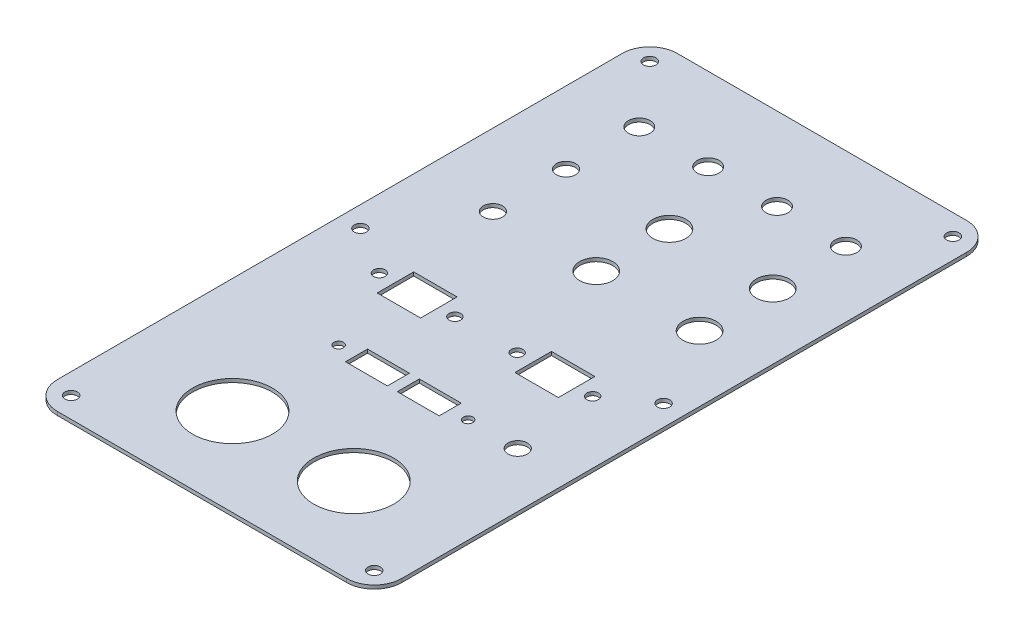
from build123d import *

# Parameters (mm, degrees)
SKETCH1_W          = 125
SKETCH1_H          = 225
BASE_FLANGE1_DEPTH = 1.3
SKETCH6_R          = 2.25
CUT_EXTRUDE1_DEPTH = 10
FILLET1_R          = 10
SKETCH7_R          = 14.5
SKETCH7_R_2        = 1.75
SKETCH7_R_3        = 2.1
SKETCH7_R_4        = 3.96875
SKETCH7_W          = 15.2
SKETCH7_H          = 8
SKETCH7_W_2        = 15.75
SKETCH7_H_2        = 13.25
CUT_EXTRUDE2_DEPTH = 10
SKETCH8_R          = 3.5
CUT_EXTRUDE3_DEPTH = 10
SKETCH9_R          = 6
CUT_EXTRUDE4_DEPTH = 10


# Sheet-metal steps are written as plain solids
with BuildPart() as part:
    # Sketch1 → Base-Flange1 (new body)
    with BuildSketch(Plane(origin=(0, 0, 0), x_dir=(1, 0, 0), z_dir=(0, 1, 0))):
        with Locations((-1.187869711, 10.618580575)):
            Rectangle(SKETCH1_W, SKETCH1_H)
    extrude(amount=-BASE_FLANGE1_DEPTH)

    # Sketch6 → Cut-Extrude1 (cut)
    with BuildSketch(Plane(origin=(0, 0, 0), x_dir=(1, 0, 0), z_dir=(0, 1, 0))):
        with Locations(Location((53.812130289, 115.618580576, 0), (0, 0, 270))):
            Circle(SKETCH6_R)
        with Locations(Location((53.812130289, -94.381419424, 0), (0, 0, 270))):
            Circle(SKETCH6_R)
        with Locations(Location((-56.187869711, -94.381419424, 0), (0, 0, 270))):
            Circle(SKETCH6_R)
        with Locations(Location((-56.187869711, 115.618580576, 0), (0, 0, 270))):
            Circle(SKETCH6_R)
        with Locations(Location((53.812130289, 10.618580576, 0), (0, 0, 270))):
            Circle(SKETCH6_R)
        with Locations(Location((-56.187869711, 10.618580576, 0), (0, 0, 270))):
            Circle(SKETCH6_R)
    extrude(amount=-CUT_EXTRUDE1_DEPTH, mode=Mode.SUBTRACT)

    # Fillet1
    fillet1_edges = [part.edges().sort_by_distance(p)[0] for p in [
        (61.312130289, -0.65, 101.881419425),
        (-63.687869711, -0.65, 101.881419425),
        (-63.687869711, -0.65, -123.118580575),
        (61.312130289, -0.65, -123.118580575),
    ]]
    fillet(fillet1_edges, radius=FILLET1_R)

    # Sketch7 → Cut-Extrude2 (cut)
    with BuildSketch(Plane(origin=(0, 0, 0), x_dir=(1, 0, 0), z_dir=(0, 1, 0))):
        with Locations(Location((22, -70, 0), (0, 0, 270))):
            Circle(SKETCH7_R)
        with Locations(Location((-22, -70, 0), (0, 0, 270))):
            Circle(SKETCH7_R)
        with Locations(Location((23.5, -30, 0), (0, 0, 270))):
            Circle(SKETCH7_R_2)
        with Locations(Location((-23.5, -30, 0), (0, 0, 270))):
            Circle(SKETCH7_R_2)
        with Locations(Location((11.3, 0, 0), (0, 0, 270))):
            Circle(SKETCH7_R_3)
        with Locations(Location((38.7, 0, 0), (0, 0, 270))):
            Circle(SKETCH7_R_3)
        with Locations(Location((-12.5, 93.118580575, 0), (0, 0, 270))):
            Circle(SKETCH7_R_4)
        with Locations(Location((-37.5, 93.118580575, 0), (0, 0, 270))):
            Circle(SKETCH7_R_4)
        with Locations(Location((-38.7, 0, 0), (0, 0, 270))):
            Circle(SKETCH7_R_3)
        with Locations(Location((-11.3, 0, 0), (0, 0, 270))):
            Circle(SKETCH7_R_3)
        with Locations(Location((37.5, 93.118580575, 0), (0, 0, 270))):
            Circle(SKETCH7_R_4)
        with Locations(Location((12.5, 93.118580575, 0), (0, 0, 270))):
            Circle(SKETCH7_R_4)
        with Locations((9.4, -30)):
            Rectangle(SKETCH7_W, SKETCH7_H)
        with Locations((-9.4, -30)):
            Rectangle(SKETCH7_W, SKETCH7_H)
        with Locations((25, 0)):
            Rectangle(SKETCH7_W_2, SKETCH7_H_2)
        with Locations((-25, 0)):
            Rectangle(SKETCH7_W_2, SKETCH7_H_2)
    extrude(amount=-CUT_EXTRUDE2_DEPTH, mode=Mode.SUBTRACT)

    # Sketch8 → Cut-Extrude3 (cut)
    with BuildSketch(Plane(origin=(0, 0, 0), x_dir=(1, 0, 0), z_dir=(0, 1, 0))):
        with Locations(Location((-37.5, 66.559290288, 0), (0, 0, 270))):
            Circle(SKETCH8_R)
        with Locations(Location((-37.5, 40, 0), (0, 0, 270))):
            Circle(SKETCH8_R)
        with Locations(Location((41.5, -30, 0), (0, 0, 270))):
            Circle(SKETCH8_R)
    extrude(amount=-CUT_EXTRUDE3_DEPTH, mode=Mode.SUBTRACT)

    # Sketch9 → Cut-Extrude4 (cut)
    with BuildSketch(Plane(origin=(0, 0, 0), x_dir=(1, 0, 0), z_dir=(0, 1, 0))):
        with Locations(Location((37.5, 40, 0), (0, 0, 270))):
            Circle(SKETCH9_R)
        with Locations(Location((37.5, 66.559290288, 0), (0, 0, 270))):
            Circle(SKETCH9_R)
        with Locations(Location((0, 66.559290288, 0), (0, 0, 270))):
            Circle(SKETCH9_R)
        with Locations(Location((0, 40, 0), (0, 0, 270))):
            Circle(SKETCH9_R)
    extrude(amount=-CUT_EXTRUDE4_DEPTH, mode=Mode.SUBTRACT)


solid = part.part
